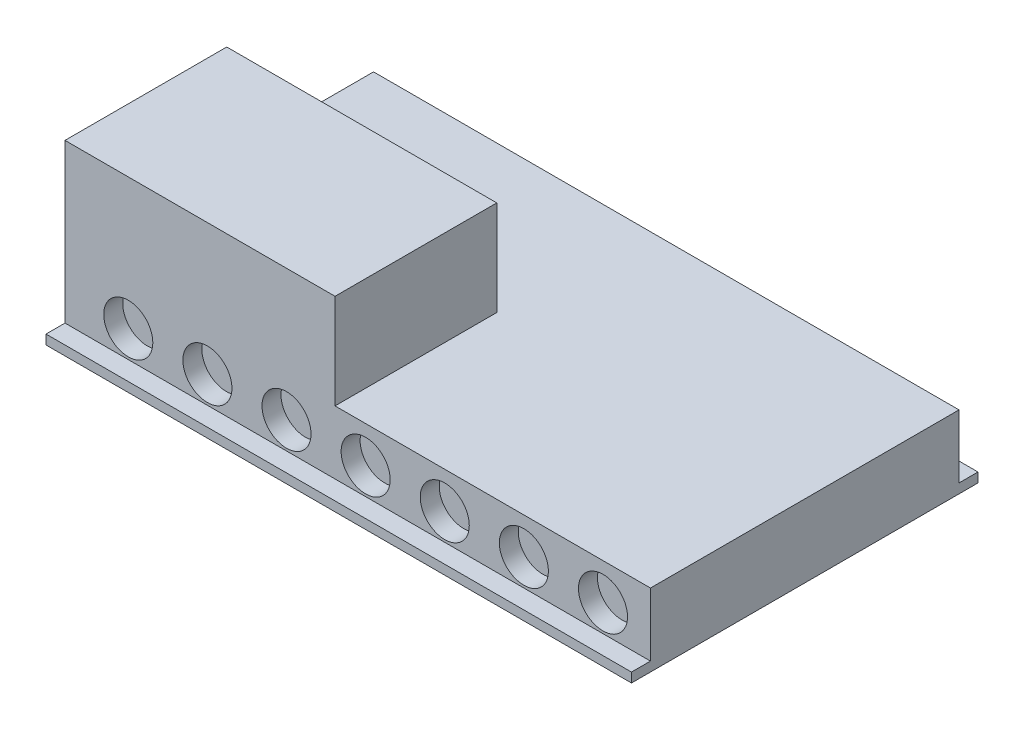
from build123d import *

# Parameters (mm, degrees)
SKETCH1_W           = 185
SKETCH1_H           = 97.5
BOSS_EXTRUDE1_DEPTH = 23
SKETCH7_W           = 85.330147009
SKETCH7_H           = 51.108504273
BOSS_EXTRUDE5_DEPTH = 30
SKETCH9_W           = 185
SKETCH9_H           = 3
BOSS_EXTRUDE6_DEPTH = 6
SKETCH10_W          = 185
SKETCH10_H          = 3
BOSS_EXTRUDE7_DEPTH = 6
SKETCH11_R          = 7.75
CUT_EXTRUDE2_DEPTH  = 6


with BuildPart() as part:
    # Sketch1 → Boss-Extrude1 (new body)
    with BuildSketch(Plane(origin=(0, 0, 0), x_dir=(1, 0, 0), z_dir=(0, 1, 0))):
        with Locations((92.5, 48.75)):
            Rectangle(SKETCH1_W, SKETCH1_H)
    extrude(amount=BOSS_EXTRUDE1_DEPTH)

    # Sketch7 → Boss-Extrude5 (add)
    with BuildSketch(Plane(origin=(0, 23, 0), x_dir=(1, 0, 0), z_dir=(0, 1, 0))):
        with Locations((42.665073505, 25.554252137)):
            Rectangle(SKETCH7_W, SKETCH7_H)
    extrude(amount=BOSS_EXTRUDE5_DEPTH)

    # Sketch9 → Boss-Extrude6 (add)
    with BuildSketch(Plane.XY):
        with Locations((92.5, 1.5)):
            Rectangle(SKETCH9_W, SKETCH9_H)
    extrude(amount=BOSS_EXTRUDE6_DEPTH)

    # Sketch10 → Boss-Extrude7 (add)
    with BuildSketch(Plane(origin=(0, 0, -97.5), x_dir=(-1, 0, 0), z_dir=(0, 0, -1))):
        with Locations((-92.5, 1.5)):
            Rectangle(SKETCH10_W, SKETCH10_H)
    extrude(amount=BOSS_EXTRUDE7_DEPTH)

    # Sketch11 → Cut-Extrude2 (cut)
    with BuildSketch(Plane.XY):
        with Locations((170, 11.5)):
            Circle(SKETCH11_R)
        with Locations((145, 11.5)):
            Circle(SKETCH11_R)
        with Locations((120, 11.5)):
            Circle(SKETCH11_R)
        with Locations((95, 11.5)):
            Circle(SKETCH11_R)
        with Locations((70, 11.5)):
            Circle(SKETCH11_R)
        with Locations((45, 11.5)):
            Circle(SKETCH11_R)
        with Locations((20, 11.5)):
            Circle(SKETCH11_R)
    extrude(amount=-CUT_EXTRUDE2_DEPTH, mode=Mode.SUBTRACT)


solid = part.part
